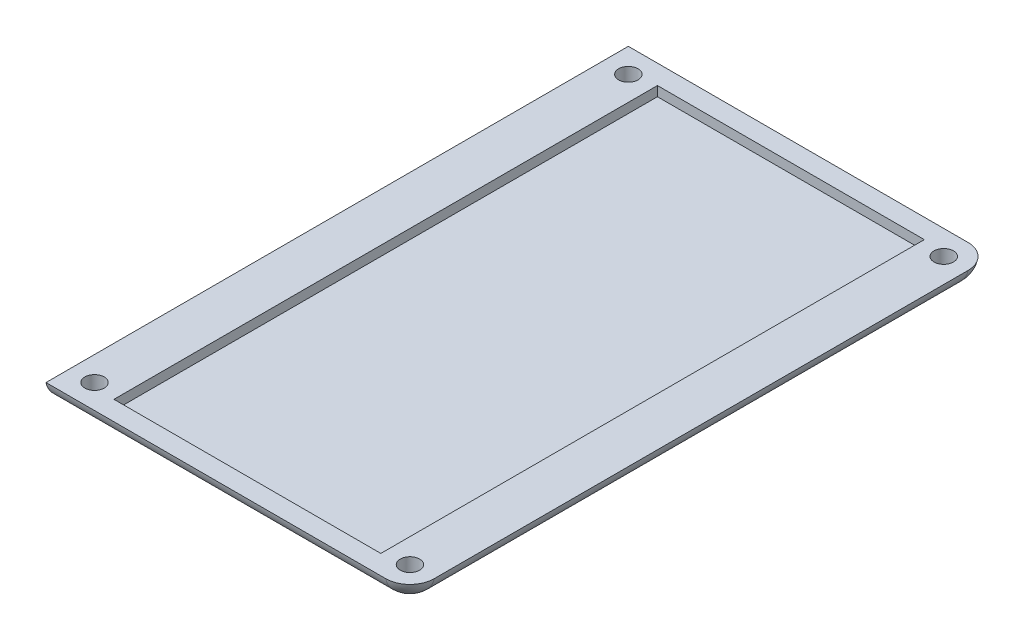
from build123d import *

# Parameters (mm, degrees)
SKETCH1_W           = 37.5
SKETCH1_H           = 60
BOSS_EXTRUDE1_DEPTH = 2
SKETCH2_R           = 1
CUT_EXTRUDE1_DEPTH  = 71.783119457
SKETCH3_W           = 27.5
SKETCH3_H           = 56
CUT_EXTRUDE2_DEPTH  = 1
FILLET1_R           = 2.5
FILLET2_R           = 2.5


with BuildPart() as part:
    # Sketch1 → Boss-Extrude1 (new body)
    with BuildSketch(Plane(origin=(0, 0, 0), x_dir=(1, 0, 0), z_dir=(0, 1, 0))):
        with Locations((18.75, 30)):
            Rectangle(SKETCH1_W, SKETCH1_H)
    extrude(amount=BOSS_EXTRUDE1_DEPTH)

    # Sketch2 → Cut-Extrude1 (cut, through all)
    with BuildSketch(Plane(origin=(0, 2, 0), x_dir=(1, 0, 0), z_dir=(0, 1, 0))):
        with Locations(Location((2.5, 57.5, 0), (0, 0, 270))):
            Circle(SKETCH2_R)
        with Locations(Location((35, 57.5, 0), (0, 0, 270))):
            Circle(SKETCH2_R)
        with Locations(Location((35, 2.5, 0), (0, 0, 270))):
            Circle(SKETCH2_R)
        with Locations(Location((2.5, 2.5, 0), (0, 0, 270))):
            Circle(SKETCH2_R)
    extrude(amount=-CUT_EXTRUDE1_DEPTH, mode=Mode.SUBTRACT)

    # Sketch3 → Cut-Extrude2 (cut)
    with BuildSketch(Plane(origin=(0, 2, 0), x_dir=(1, 0, 0), z_dir=(0, 1, 0))):
        with Locations((18.75, 30)):
            Rectangle(SKETCH3_W, SKETCH3_H)
    extrude(amount=-CUT_EXTRUDE2_DEPTH, mode=Mode.SUBTRACT)

    # Fillet1
    fillet1_edges = [part.edges().sort_by_distance(p)[0] for p in [
        (37.5, 1, -60),
        (37.5, 1, 0),
    ]]
    fillet(fillet1_edges, radius=FILLET1_R)

    # Fillet2
    # the kernel refuses this fillet: 2.5 mm, written as the material it takes off along each edge
    with BuildSketch(Plane(origin=(35, 0, -60), x_dir=(0, 0, 1), z_dir=(-1, 0, 0))) as fillet2_piece_1:
        with BuildLine():
            CenterArc((2.449489743, 2.5), FILLET2_R, 191.536959033, 78.463040967)
            Line((0, 2), (0, 0))
            Line((0, 0), (2.449489743, 0))
        make_face()
    extrude(amount=41.123724357, mode=Mode.SUBTRACT)
    with BuildSketch(Plane(origin=(37.5, 0, -2.5), x_dir=(-1, 0, 0), z_dir=(0, 0, -1))) as fillet2_piece_2:
        with BuildLine():
            CenterArc((2.449489743, 2.5), FILLET2_R, 191.536959033, 78.463040967)
            Line((0, 2), (0, 0))
            Line((0, 0), (2.449489743, 0))
        make_face()
    extrude(amount=55, mode=Mode.SUBTRACT)
    with BuildSketch(Plane(origin=(-6.123724357, 0, 0), x_dir=(0, 1.0, -1.574296248917966e-12), z_dir=(1, 0, 0))) as fillet2_piece_3:
        with BuildLine():
            CenterArc((2.5, -2.449489743), FILLET2_R, 101.536959033, 78.463040967)
            Line((0, -2.449489743), (0, 0))
            Line((0, 0), (2, 0))
        make_face()
    extrude(amount=41.123724357, mode=Mode.SUBTRACT)
    with BuildSketch(Plane(origin=(35, 0, -2.5), x_dir=(0, 0, 1), z_dir=(-1, 0, 0))) as fillet2_piece_4:
        with BuildLine():
            CenterArc((0.050510257, 2.5), FILLET2_R, 270, 78.463040967)
            Line((2.5, 2), (2.5, 0))
            Line((2.5, 0), (0.050510257, 0))
        make_face()
    revolve(axis=Axis((35, 0, -2.5), (0, 1, 0)), revolution_arc=90, mode=Mode.SUBTRACT)
    with BuildSketch(Plane(origin=(35, 0, -57.5), x_dir=(1, 0, 0), z_dir=(0, 0, 1))) as fillet2_piece_5:
        with BuildLine():
            CenterArc((0.050510257, 2.5), FILLET2_R, 270, 78.463040967)
            Line((2.5, 2), (2.5, 0))
            Line((2.5, 0), (0.050510257, 0))
        make_face()
    revolve(axis=Axis((35, 0, -57.5), (0, 1, 0)), revolution_arc=90, mode=Mode.SUBTRACT)


solid = part.part
